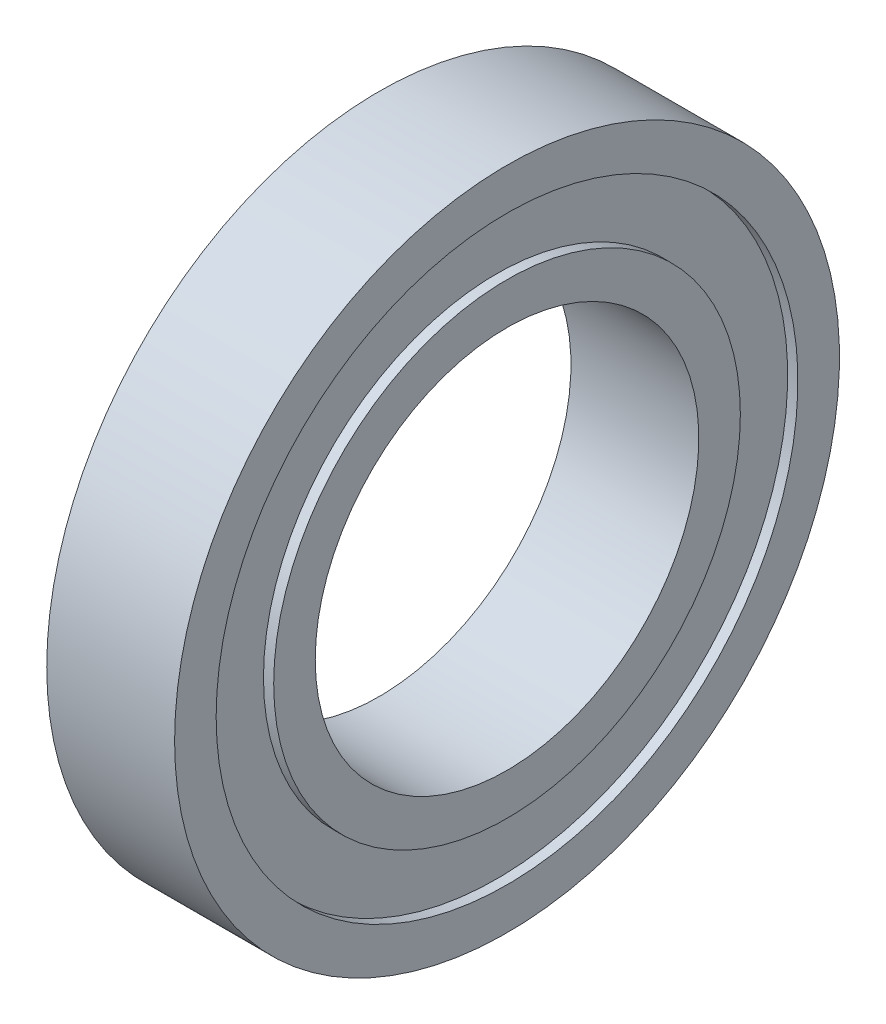
from build123d import *


with BuildPart() as part:
    # Sketch1 → Revolve1 (revolve)
    with BuildSketch(Plane(origin=(0, 0, 0), x_dir=(1, 0, 0), z_dir=(0, 1, 0))):
        Polygon((0, 7.5), (0, 9.125), (0.4, 9.125), (0.4, 11.375), (0, 11.375), (0, 13), (5, 13), (5, 11.375), (4.6, 11.375), (4.6, 9.125), (5, 9.125), (5, 7.5), align=None)
    revolve(axis=Axis((0, 0, 0), (1, 0, 0)))


solid = part.part
